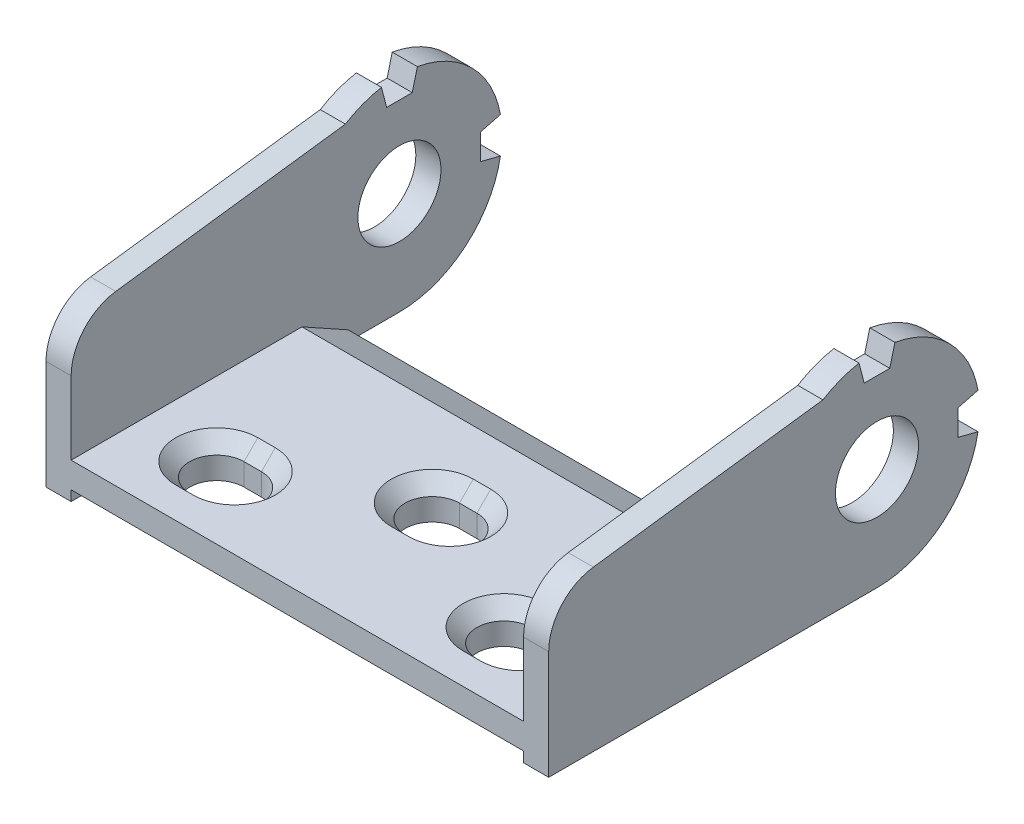
from build123d import *

# Parameters (mm, degrees)
BODY_DEPTH                       = 32
BODY_DEPTH_BACK                  = 15
PIVOT_HOLE_DEPTH                 = 42.979905907
PIVOT_HOLE_DEPTH_BACK            = 42.979905907
PIVOT_HOLE_SKETCH_R              = 4.05
OUTSIDE_SHAPE_CUT_OUT_DEPTH      = 42.979905907
OUTSIDE_SHAPE_CUT_OUT_DEPTH_BACK = 42.979905907
OUTSIDE_SHAPE_CUT_OUT_SKETCH_W   = 49
OUTSIDE_SHAPE_CUT_OUT_SKETCH_H   = 22
INSIDE_START                     = 22.05
INSIDE_SHAPE_CUT_OUT_DEPTH       = 44.1
F_3_START                        = -11.75
F_3_M5_SLOTS_DEPTH               = 3.5


with BuildPart() as part:
    # Profile Sketch → Body (new, two sides: drawn at the far end of the back side and taken through both)
    with BuildSketch(Plane.XY.offset(-BODY_DEPTH_BACK)):
        Polygon((-24.5, -11.75), (24.5, -11.75), (24.5, 8.25), (22.05, 8.25), (22.05, -8.25), (-22.05, -8.25), (-22.05, 8.25), (-24.5, 8.25), align=None)
    extrude(amount=BODY_DEPTH + BODY_DEPTH_BACK)

    # Pivot Hole Sketch → Pivot Hole (cut, two sides: drawn at the far end of the back side and taken through both)
    with BuildSketch(Plane(origin=(0, 0, 0), x_dir=(0, 0, -1), z_dir=(1, 0, 0)).offset(-PIVOT_HOLE_DEPTH_BACK)):
        with Locations((0, -1.75)):
            Circle(PIVOT_HOLE_SKETCH_R)
    extrude(amount=PIVOT_HOLE_DEPTH + PIVOT_HOLE_DEPTH_BACK, mode=Mode.SUBTRACT)

    # Outside Shape Cut Out Sketch → Outside Shape Cut Out (cut, two sides: drawn at the far end of the back side and taken through both)
    with BuildSketch(Plane(origin=(0, 0, 0), x_dir=(0, 0, -1), z_dir=(1, 0, 0)).offset(-OUTSIDE_SHAPE_CUT_OUT_DEPTH_BACK)):
        with Locations((-9.5, -2.75)):
            Rectangle(OUTSIDE_SHAPE_CUT_OUT_SKETCH_W, OUTSIDE_SHAPE_CUT_OUT_SKETCH_H)
        with BuildLine():
            Line((-27.649101987, 3.819656009), (-5.267826876, 6.75))
            ThreePointArc((-5.267826876, 6.75), (-3.57284062, 7.589957703), (-1.75, 8.095684334))
            Line((-1.75, 8.095684334), (-1.25, 6.15))
            Line((-1.25, 6.15), (1.25, 6.15))
            Line((1.25, 6.15), (1.75, 8.095684334))
            ThreePointArc((1.75, 8.095684334), (7.071067812, 5.321067812), (9.845684334, 0))
            Line((9.845684334, 0), (7.9, -0.5))
            Line((7.9, -0.5), (7.9, -3))
            Line((7.9, -3), (9.845684334, -3.5))
            ThreePointArc((9.845684334, -3.5), (6.422616289, -9.414854858), (0, -11.75))
            Line((0, -11.75), (-32, -11.75))
            Line((-32, -11.75), (-32, -1.138031619))
            ThreePointArc((-32, -1.138031619), (-30.758025408, 2.160035244), (-27.649101987, 3.819656009))
        make_face(mode=Mode.SUBTRACT)
    extrude(amount=OUTSIDE_SHAPE_CUT_OUT_DEPTH + OUTSIDE_SHAPE_CUT_OUT_DEPTH_BACK, mode=Mode.SUBTRACT)

    # Inside Shape Cut Out Sketch → Inside Shape Cut Out (cut)
    with BuildSketch(Plane(origin=(0, 0, 0), x_dir=(0, 0, -1), z_dir=(1, 0, 0)).offset(INSIDE_START)):
        Polygon((-29, -9.75), (-29, -11.75), (-32, -11.75), (-32, -10.75), (-30.5, -10.75), (-30.5, -9.75), align=None)
        Polygon((-9.5, -8.25), (-5, -10.75), (-5, -11.75), (7.599342077, -11.75), (7.599342077, -8.25), align=None)
    extrude(amount=-INSIDE_SHAPE_CUT_OUT_DEPTH, mode=Mode.SUBTRACT)

    # 3 M5 Slots: read off the stored shape, not the designer's step
    # 3 M5 Slots outline → 3 M5 Slots (cut)
    with BuildSketch(Plane(origin=(0, 0, 0), x_dir=(1, 0, 0), z_dir=(0, 1, 0)).offset(F_3_START)):
        with BuildLine():
            Line((-0.85, -20.65), (0.85, -20.65))
            ThreePointArc((0.85, -20.65), (3.5, -18), (0.85, -15.35))
            Line((0.85, -15.35), (-0.85, -15.35))
            ThreePointArc((-0.85, -15.35), (-3.5, -18), (-0.85, -20.65))
        make_face()
        with BuildLine():
            Line((13.15, -27.65), (14.85, -27.65))
            ThreePointArc((14.85, -27.65), (17.5, -25), (14.85, -22.35))
            Line((14.85, -22.35), (13.15, -22.35))
            ThreePointArc((13.15, -22.35), (10.5, -25), (13.15, -27.65))
        make_face()
        with BuildLine():
            ThreePointArc((-13.15, -27.65), (-10.5, -25), (-13.15, -22.35))
            Line((-13.15, -22.35), (-14.85, -22.35))
            ThreePointArc((-14.85, -22.35), (-17.5, -25), (-14.85, -27.65))
            Line((-14.85, -27.65), (-13.15, -27.65))
        make_face()
    extrude(amount=F_3_M5_SLOTS_DEPTH, mode=Mode.SUBTRACT)

    # 3 M5 Slots 2: loft between two sections, ruled curve by curve
    f_3_m5_slots_2_from = [
        Edge.make_three_point_arc((0.85, -9.6, 20.65), (2.72383297, -9.6, 19.87383297), (3.5, -9.6, 18)),
        Edge.make_three_point_arc((3.5, -9.6, 18), (2.72383297, -9.6, 16.12616703), (0.85, -9.6, 15.35)),
        Edge.make_three_point_arc((-0.85, -9.6, 15.35), (-2.72383297, -9.6, 16.12616703), (-3.5, -9.6, 18)),
        Edge.make_three_point_arc((-3.5, -9.6, 18), (-2.72383297, -9.6, 19.87383297), (-0.85, -9.6, 20.65)),
        Edge.make_line((0.85, -9.6, 15.35), (-0.85, -9.6, 15.35)),
        Edge.make_line((0.85, -9.6, 20.65), (-0.85, -9.6, 20.65)),
    ]
    f_3_m5_slots_2_to = [
        Edge.make_three_point_arc((0.85, -8.25, 22), (3.678427125, -8.25, 20.828427125), (4.85, -8.25, 18)),
        Edge.make_three_point_arc((4.85, -8.25, 18), (3.678427125, -8.25, 15.171572875), (0.85, -8.25, 14)),
        Edge.make_three_point_arc((-0.85, -8.25, 14), (-3.678427125, -8.25, 15.171572875), (-4.85, -8.25, 18)),
        Edge.make_three_point_arc((-4.85, -8.25, 18), (-3.678427125, -8.25, 20.828427125), (-0.85, -8.25, 22)),
        Edge.make_line((0.85, -8.25, 14), (-0.85, -8.25, 14)),
        Edge.make_line((0.85, -8.25, 22), (-0.85, -8.25, 22)),
    ]
    f_3_m5_slots_2 = Solid(Shell([*[Face.make_surface_from_curves(f_3_m5_slots_2_from[k], f_3_m5_slots_2_to[k]) for k in range(6)], Face(Wire(f_3_m5_slots_2_from)), Face(Wire(f_3_m5_slots_2_to))]))
    add(f_3_m5_slots_2, mode=Mode.SUBTRACT)

    # 3 M5 Slots 3: loft between two sections, ruled curve by curve
    f_3_m5_slots_3_from = [
        Edge.make_three_point_arc((14.85, -9.6, 27.65), (16.72383297, -9.6, 26.87383297), (17.5, -9.6, 25)),
        Edge.make_three_point_arc((17.5, -9.6, 25), (16.72383297, -9.6, 23.12616703), (14.85, -9.6, 22.35)),
        Edge.make_three_point_arc((13.15, -9.6, 22.35), (11.27616703, -9.6, 23.12616703), (10.5, -9.6, 25)),
        Edge.make_three_point_arc((10.5, -9.6, 25), (11.27616703, -9.6, 26.87383297), (13.15, -9.6, 27.65)),
        Edge.make_line((14.85, -9.6, 22.35), (13.15, -9.6, 22.35)),
        Edge.make_line((14.85, -9.6, 27.65), (13.15, -9.6, 27.65)),
    ]
    f_3_m5_slots_3_to = [
        Edge.make_three_point_arc((14.85, -8.25, 29), (17.678427125, -8.25, 27.828427125), (18.85, -8.25, 25)),
        Edge.make_three_point_arc((18.85, -8.25, 25), (17.678427125, -8.25, 22.171572875), (14.85, -8.25, 21)),
        Edge.make_three_point_arc((13.15, -8.25, 21), (10.321572875, -8.25, 22.171572875), (9.15, -8.25, 25)),
        Edge.make_three_point_arc((9.15, -8.25, 25), (10.321572875, -8.25, 27.828427125), (13.15, -8.25, 29)),
        Edge.make_line((14.85, -8.25, 21), (13.15, -8.25, 21)),
        Edge.make_line((14.85, -8.25, 29), (13.15, -8.25, 29)),
    ]
    f_3_m5_slots_3 = Solid(Shell([*[Face.make_surface_from_curves(f_3_m5_slots_3_from[k], f_3_m5_slots_3_to[k]) for k in range(6)], Face(Wire(f_3_m5_slots_3_from)), Face(Wire(f_3_m5_slots_3_to))]))
    add(f_3_m5_slots_3, mode=Mode.SUBTRACT)

    # 3 M5 Slots 4: loft between two sections, ruled curve by curve
    f_3_m5_slots_4_from = [
        Edge.make_three_point_arc((-13.15, -9.6, 27.65), (-11.27616703, -9.6, 26.87383297), (-10.5, -9.6, 25)),
        Edge.make_three_point_arc((-10.5, -9.6, 25), (-11.27616703, -9.6, 23.12616703), (-13.15, -9.6, 22.35)),
        Edge.make_three_point_arc((-14.85, -9.6, 22.35), (-16.72383297, -9.6, 23.12616703), (-17.5, -9.6, 25)),
        Edge.make_three_point_arc((-17.5, -9.6, 25), (-16.72383297, -9.6, 26.87383297), (-14.85, -9.6, 27.65)),
        Edge.make_line((-13.15, -9.6, 22.35), (-14.85, -9.6, 22.35)),
        Edge.make_line((-13.15, -9.6, 27.65), (-14.85, -9.6, 27.65)),
    ]
    f_3_m5_slots_4_to = [
        Edge.make_three_point_arc((-13.15, -8.25, 29), (-10.321572875, -8.25, 27.828427125), (-9.15, -8.25, 25)),
        Edge.make_three_point_arc((-9.15, -8.25, 25), (-10.321572875, -8.25, 22.171572875), (-13.15, -8.25, 21)),
        Edge.make_three_point_arc((-14.85, -8.25, 21), (-17.678427125, -8.25, 22.171572875), (-18.85, -8.25, 25)),
        Edge.make_three_point_arc((-18.85, -8.25, 25), (-17.678427125, -8.25, 27.828427125), (-14.85, -8.25, 29)),
        Edge.make_line((-13.15, -8.25, 21), (-14.85, -8.25, 21)),
        Edge.make_line((-13.15, -8.25, 29), (-14.85, -8.25, 29)),
    ]
    f_3_m5_slots_4 = Solid(Shell([*[Face.make_surface_from_curves(f_3_m5_slots_4_from[k], f_3_m5_slots_4_to[k]) for k in range(6)], Face(Wire(f_3_m5_slots_4_from)), Face(Wire(f_3_m5_slots_4_to))]))
    add(f_3_m5_slots_4, mode=Mode.SUBTRACT)


solid = part.part
